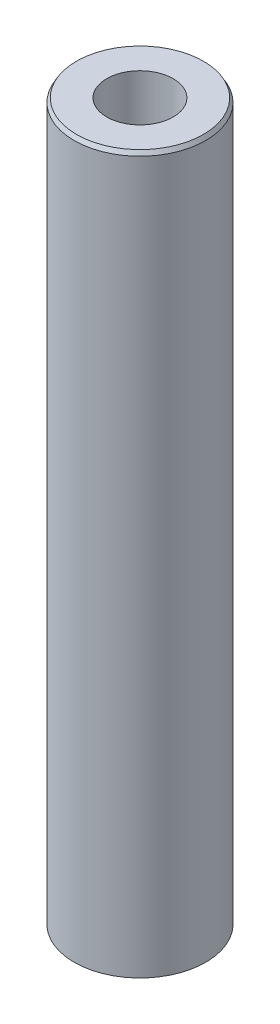
from build123d import *
from OCP.BRepFilletAPI import BRepFilletAPI_MakeChamfer

# Parameters (mm, degrees)
SKETCH1_R           = 55
BOSS_EXTRUDE1_DEPTH = 600
SKETCH2_R           = 27.765550374
CUT_EXTRUDE1_DEPTH  = 606.020660804
CHAMFER1_SIZE       = 3.410440289
CHAMFER1_SIZE2      = 1.969018619


with BuildPart() as part:
    # Sketch1 → Boss-Extrude1 (new body)
    with BuildSketch(Plane(origin=(0, 0, 0), x_dir=(1, 0, 0), z_dir=(0, 1, 0))):
        Circle(SKETCH1_R)
    extrude(amount=BOSS_EXTRUDE1_DEPTH)

    # Sketch2 → Cut-Extrude1 (cut, through all)
    with BuildSketch(Plane(origin=(0, 0, 0), x_dir=(1, 0, 0), z_dir=(0, 1, 0))):
        Circle(SKETCH2_R)
    extrude(amount=CUT_EXTRUDE1_DEPTH, mode=Mode.SUBTRACT)

    # Chamfer1: one chamfer whose edges measure the first distance from different faces: ONE call of the kernel's chamfer builder (chamfer() names one face for all edges)
    chamfer1_edges_1 = [part.edges().sort_by_distance(p)[0] for p in [
        (-55, 600, 0),
    ]]
    chamfer1_side_1 = [part.faces().sort_by_distance(p)[0] for p in [
        (-55, 300, 0),
    ]]
    chamfer1_edges_2 = [part.edges().sort_by_distance(p)[0] for p in [
        (-55, 0, 0),
    ]]
    chamfer1_side_2 = [part.faces().sort_by_distance(p)[0] for p in [
        (-53.444365081, 0, 0),
    ]]
    chamfer1 = BRepFilletAPI_MakeChamfer(part.part.solid().wrapped)
    for e in chamfer1_edges_1:
        chamfer1.Add(CHAMFER1_SIZE, CHAMFER1_SIZE2, e.wrapped, chamfer1_side_1[0].wrapped)  # the first distance lies on this face
    for e in chamfer1_edges_2:
        chamfer1.Add(CHAMFER1_SIZE, CHAMFER1_SIZE2, e.wrapped, chamfer1_side_2[0].wrapped)  # the first distance lies on this face
    add(Compound.cast(chamfer1.Shape()), mode=Mode.REPLACE)


solid = part.part
